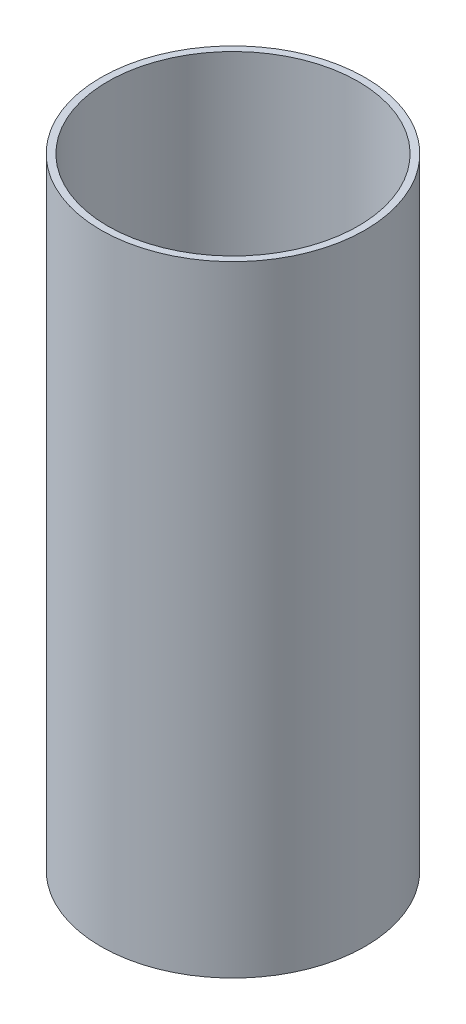
from build123d import *

# Parameters (mm, degrees)
SKETCH1_R           = 57.5
SKETCH1_R_2         = 54.5
BOSS_EXTRUDE1_DEPTH = 270


with BuildPart() as part:
    # Sketch1 → Boss-Extrude1 (new body)
    with BuildSketch(Plane(origin=(0, 0, 0), x_dir=(1, 0, 0), z_dir=(0, 1, 0))):
        Circle(SKETCH1_R)
        Circle(SKETCH1_R_2, mode=Mode.SUBTRACT)
    extrude(amount=BOSS_EXTRUDE1_DEPTH)


solid = part.part
